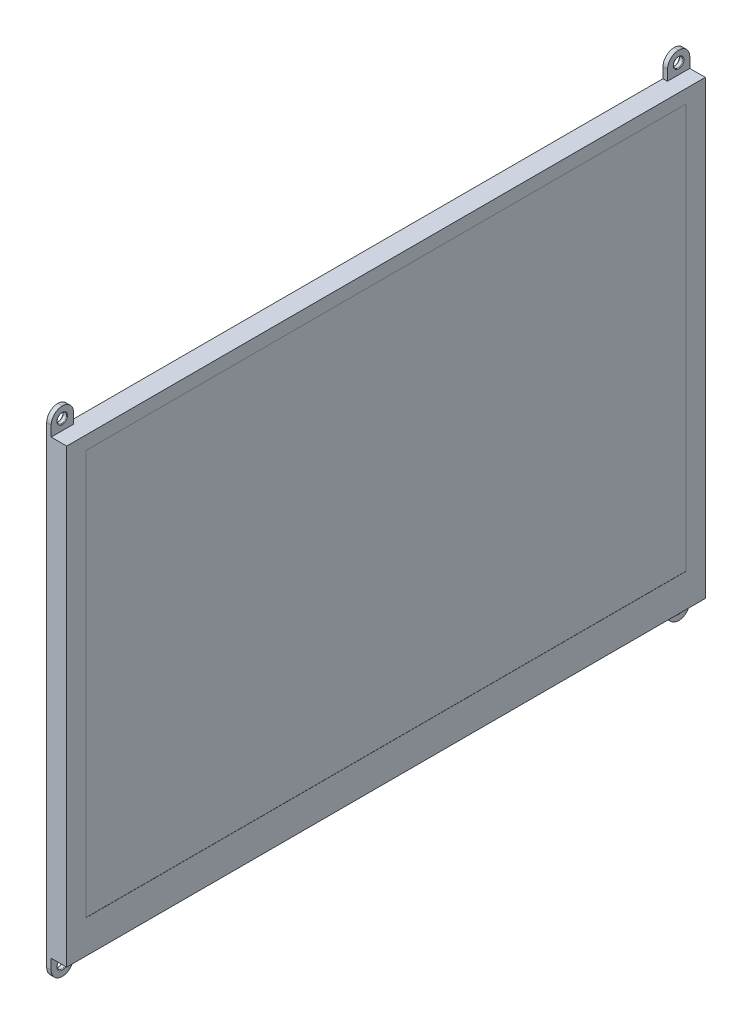
from build123d import *

# Parameters (mm, degrees)
SKETCH1_W           = 7.874
SKETCH1_H           = 8.2042
SKETCH1_R           = 1.75
SKETCH1_W_2         = 166.0398
SKETCH1_H_2         = 234.95
BOSS_EXTRUDE1_DEPTH = 1.651
BOSS_EXTRUDE2_DEPTH = 5.715
SKETCH3_W           = 148.8821
SKETCH3_H           = 220.726
CUT_EXTRUDE1_DEPTH  = 0.05
FILLET1_R           = 4.1021
FILLET2_R           = 0.25


with BuildPart() as part:
    # Sketch1 → Boss-Extrude1 (new body)
    # profile 1 of 5: a face of its own
    with BuildSketch(Plane.YZ):
        with Locations((-86.9569, 113.3729)):
            Rectangle(SKETCH1_W, SKETCH1_H)
        with Locations(Location((-86.8939, 113.3729, 0), (0, 0, 90))):
            Circle(SKETCH1_R, mode=Mode.SUBTRACT)
    # profile 2 of 5: a face of its own
    with BuildSketch(Plane.YZ):
        Rectangle(SKETCH1_W_2, SKETCH1_H_2)
    # profile 3 of 5: a face of its own
    with BuildSketch(Plane.YZ):
        with Locations((86.9569, 113.3729)):
            Rectangle(SKETCH1_W, SKETCH1_H)
        with Locations(Location((86.8939, 113.3729, 0), (0, 0, 90))):
            Circle(SKETCH1_R, mode=Mode.SUBTRACT)
    # profile 4 of 5: a face of its own
    with BuildSketch(Plane.YZ):
        with Locations((86.9569, -113.3729)):
            Rectangle(SKETCH1_W, SKETCH1_H)
        with Locations(Location((86.8939, -113.3729, 0), (0, 0, 90))):
            Circle(SKETCH1_R, mode=Mode.SUBTRACT)
    # profile 5 of 5: a face of its own
    with BuildSketch(Plane.YZ):
        with Locations((-86.9569, -113.3729)):
            Rectangle(SKETCH1_W, SKETCH1_H)
        with Locations(Location((-86.8939, -113.3729, 0), (0, 0, 90))):
            Circle(SKETCH1_R, mode=Mode.SUBTRACT)
    extrude(amount=BOSS_EXTRUDE1_DEPTH)

    # Sketch2 → Boss-Extrude2 (add)
    with BuildSketch(Plane.YZ.offset(1.651)):
        Polygon((83.0199, 117.475), (-83.0199, 117.475), (-83.0199, 109.2708), (-83.0199, -109.2708), (-83.0199, -117.475), (83.0199, -117.475), (83.0199, -109.2708), (83.0199, 109.2708), align=None)
    extrude(amount=BOSS_EXTRUDE2_DEPTH)

    # Sketch3 → Cut-Extrude1 (cut)
    with BuildSketch(Plane.YZ.offset(7.366)):
        with Locations((3.62585, 0)):
            Rectangle(SKETCH3_W, SKETCH3_H)
    extrude(amount=-CUT_EXTRUDE1_DEPTH, mode=Mode.SUBTRACT)

    # Fillet1
    fillet1_edges = [part.edges().sort_by_distance(p)[0] for p in [
        (0.8255, -90.8939, -117.475),
        (0.8255, -90.8939, -109.2708),
        (0.8255, -90.8939, 109.2708),
        (0.8255, -90.8939, 117.475),
        (0.8255, 90.8939, 117.475),
        (0.8255, 90.8939, 109.2708),
        (0.8255, 90.8939, -109.2708),
        (0.8255, 90.8939, -117.475),
    ]]
    fillet(fillet1_edges, radius=FILLET1_R - 0.0001)  # a hair under: the kernel refuses the full size

    # Fillet2
    fillet2_edges = [part.edges().sort_by_distance(p)[0] for p in [
        (1.651, 86.8939, -115.1229),
        (0, 86.8939, -115.1229),
        (0, 86.8939, 111.6229),
        (0, -86.8939, -115.1229),
        (0, -86.8939, 111.6229),
        (1.651, -86.8939, 111.6229),
        (1.651, -86.8939, -115.1229),
        (1.651, 86.8939, 111.6229),
    ]]
    fillet(fillet2_edges, radius=FILLET2_R)


solid = part.part
